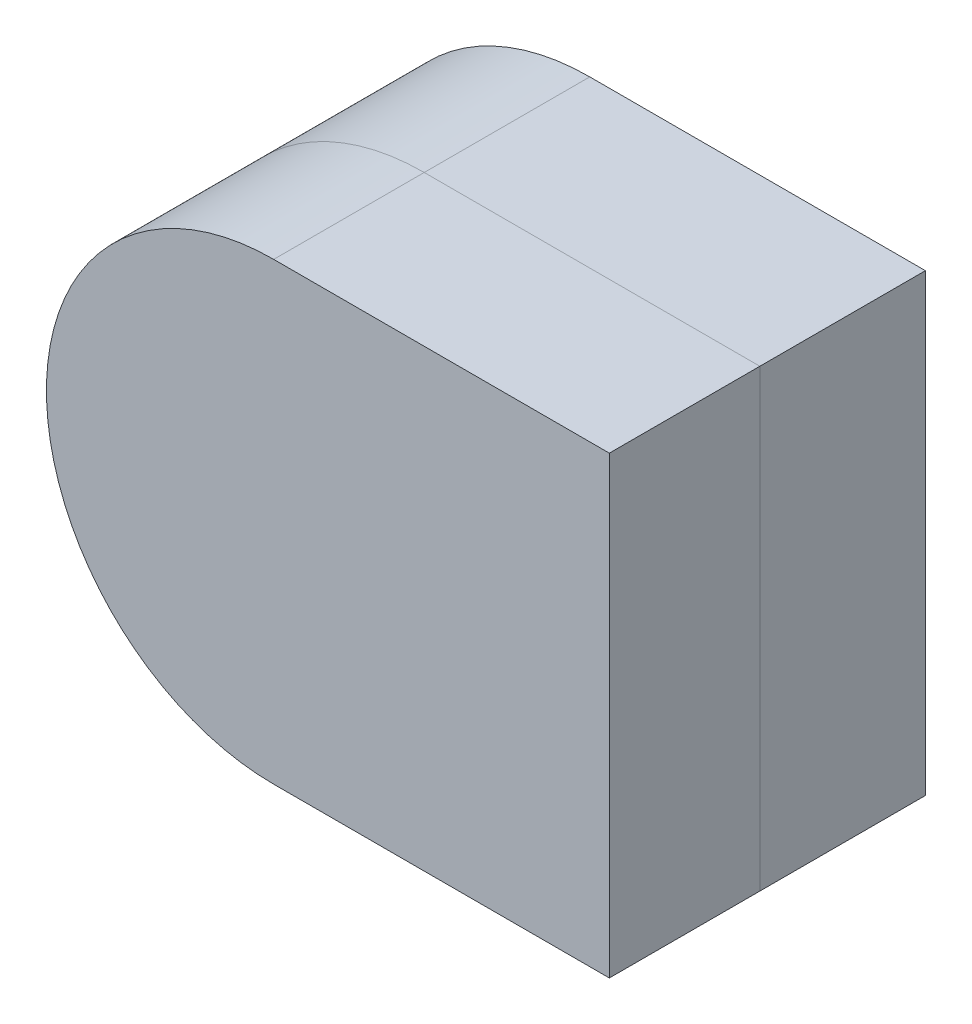
from build123d import *

# Parameters (mm, degrees)
BASE_EXTRUDE_DEPTH      = 3.81
WALLS_START             = 19.05
WALLS_EXTRUDE_DEPTH     = 19.05
TOP_START               = 3.81
TOP_EXTRUDE_DEPTH       = 3.81
BOARD_START             = 5.08
BOARD_HOLDERS_DEPTH     = 5.08
STANDOFFS_R             = 1.905
BOSS_EXTRUDE5_DEPTH     = 3.81
CUT_EXTRUDE1_START      = -5.08
CUT_EXTRUDE1_DEPTH      = 19.05
CUT_EXTRUDE2_DEPTH      = 1.27
CUT_EXTRUDE2_DEPTH_BACK = 11.43
BACK_EDGE_CUTOUT_W      = 0.508
BACK_EDGE_CUTOUT_H      = 33.274


# Read off the part's stored shape, not the designer's step: Cut-Extrude1
with BuildPart() as part:
    # walls → Base extrude (new body)
    with BuildSketch(Plane.XY):
        with BuildLine():
            Line((23.749, -19.177), (23.749, 19.177))
            Line((23.749, 19.177), (-4.572, 19.177))
            ThreePointArc((-4.572, 19.177), (-23.749, 0), (-4.572, -19.177))
            Line((-4.572, -19.177), (23.749, -19.177))
        make_face()
    extrude(amount=-BASE_EXTRUDE_DEPTH)

    # walls<4> → Walls Extrude (add)
    with BuildSketch(Plane.XY.offset(WALLS_START)):
        with BuildLine():
            Line((23.749, -19.177), (23.749, -8.763))
            Line((23.749, -8.763), (23.749, 8.763))
            Line((23.749, 8.763), (23.749, 19.177))
            Line((23.749, 19.177), (-4.572, 19.177))
            ThreePointArc((-4.572, 19.177), (-23.749, 0), (-4.572, -19.177))
            Line((-4.572, -19.177), (23.749, -19.177))
        make_face()
        with BuildLine():
            ThreePointArc((-4.572, -15.367), (-19.939, 0), (-4.572, 15.367))
            Line((-4.572, 15.367), (19.939, 15.367))
            Line((19.939, 15.367), (19.939, 8.763))
            Line((19.939, 8.763), (19.939, 4.953))
            Line((19.939, 4.953), (19.939, -4.953))
            Line((19.939, -4.953), (19.939, -8.763))
            Line((19.939, -8.763), (19.939, -15.367))
            Line((19.939, -15.367), (-4.572, -15.367))
        make_face(mode=Mode.SUBTRACT)
    extrude(amount=-WALLS_EXTRUDE_DEPTH)

    # Sketch2 → Top Extrude (add)
    with BuildSketch(Plane.XY.offset(19.05).offset(TOP_START)):
        with BuildLine():
            Line((23.749, 19.177), (-4.572, 19.177))
            ThreePointArc((-4.572, 19.177), (-23.749, 0), (-4.572, -19.177))
            Line((-4.572, -19.177), (23.749, -19.177))
            Line((23.749, -19.177), (23.749, 19.177))
        make_face()
    extrude(amount=-TOP_EXTRUDE_DEPTH)

    # walls<5> → board holders (add)
    with BuildSketch(Plane.XY.offset(BOARD_START)):
        with BuildLine():
            Line((12.477349839, 8.77935072), (9.9749062, 4.953))
            Line((9.9749062, 4.953), (19.939, 4.953))
            Line((19.939, 4.953), (19.939, 8.763))
            Line((19.939, 8.763), (12.485759525, 8.763))
            ThreePointArc((12.485759525, 8.763), (12.481556641, 8.771176368), (12.477349839, 8.77935072))
        make_face()
        Polygon((19.939, -4.953), (9.9749062, -4.953), (12.485759525, -8.763), (19.939, -8.763), align=None)
    extrude(amount=-BOARD_HOLDERS_DEPTH)

    # standoffs → Boss-Extrude5 (add)
    with BuildSketch(Plane.XY):
        with Locations(Location((15.748, 0, 0), (0, 0, 180))):
            Circle(STANDOFFS_R)
        with Locations(Location((-14.732, 0, 0), (0, 0, 180))):
            Circle(STANDOFFS_R)
    extrude(amount=BOSS_EXTRUDE5_DEPTH)


with BuildPart() as body_2:
    # Split1: the piece on the far side of the plane
    add(part.part)
    split(bisect_by=Plane.XY.offset(10.16), keep=Keep.BOTTOM)

    # Cut-Extrude1 outline → Cut-Extrude1 (cut)
    with BuildSketch(Plane(origin=(8.509, 0, 0), x_dir=(0, 0, -1), z_dir=(1, 0, 0)).offset(CUT_EXTRUDE1_START)):
        with BuildLine():
            ThreePointArc((-8.128, -17.272), (-6.985, -18.415), (-5.842, -17.272))
            Line((-5.842, -17.272), (-5.842, 17.272))
            ThreePointArc((-5.842, 17.272), (-6.985, 18.415), (-8.128, 17.272))
            Line((-8.128, 17.272), (-8.128, 17.145))
            Line((-8.128, 17.145), (-10.16, 17.145))
            Line((-10.16, 17.145), (-10.16, 16.637))
            Line((-10.16, 16.637), (-7.62, 16.637))
            Line((-7.62, 16.637), (-7.62, 17.272))
            ThreePointArc((-7.62, 17.272), (-6.985, 17.907), (-6.35, 17.272))
            Line((-6.35, 17.272), (-6.35, -17.272))
            ThreePointArc((-6.35, -17.272), (-6.985, -17.907), (-7.62, -17.272))
            Line((-7.62, -17.272), (-7.62, -16.637))
            Line((-7.62, -16.637), (-10.16, -16.637))
            Line((-10.16, -16.637), (-10.16, -17.145))
            Line((-10.16, -17.145), (-8.128, -17.145))
            Line((-8.128, -17.145), (-8.128, -17.272))
        make_face()
    extrude(amount=CUT_EXTRUDE1_DEPTH, mode=Mode.SUBTRACT)

    # back edge cutout → Cut-Extrude2 (cut, two sides: drawn at the far end of the back side and taken through both)
    with BuildSketch(Plane.XY.offset(17.78).offset(-CUT_EXTRUDE2_DEPTH_BACK)):
        with Locations((22.225, 0)):
            Rectangle(BACK_EDGE_CUTOUT_W, BACK_EDGE_CUTOUT_H)
    extrude(amount=CUT_EXTRUDE2_DEPTH + CUT_EXTRUDE2_DEPTH_BACK, mode=Mode.SUBTRACT)


with BuildPart() as part_1:
    add(part.part)

    # Split1
    split(bisect_by=Plane.XY.offset(10.16), keep=Keep.TOP)


solid = Compound([body_2.part, part_1.part])
